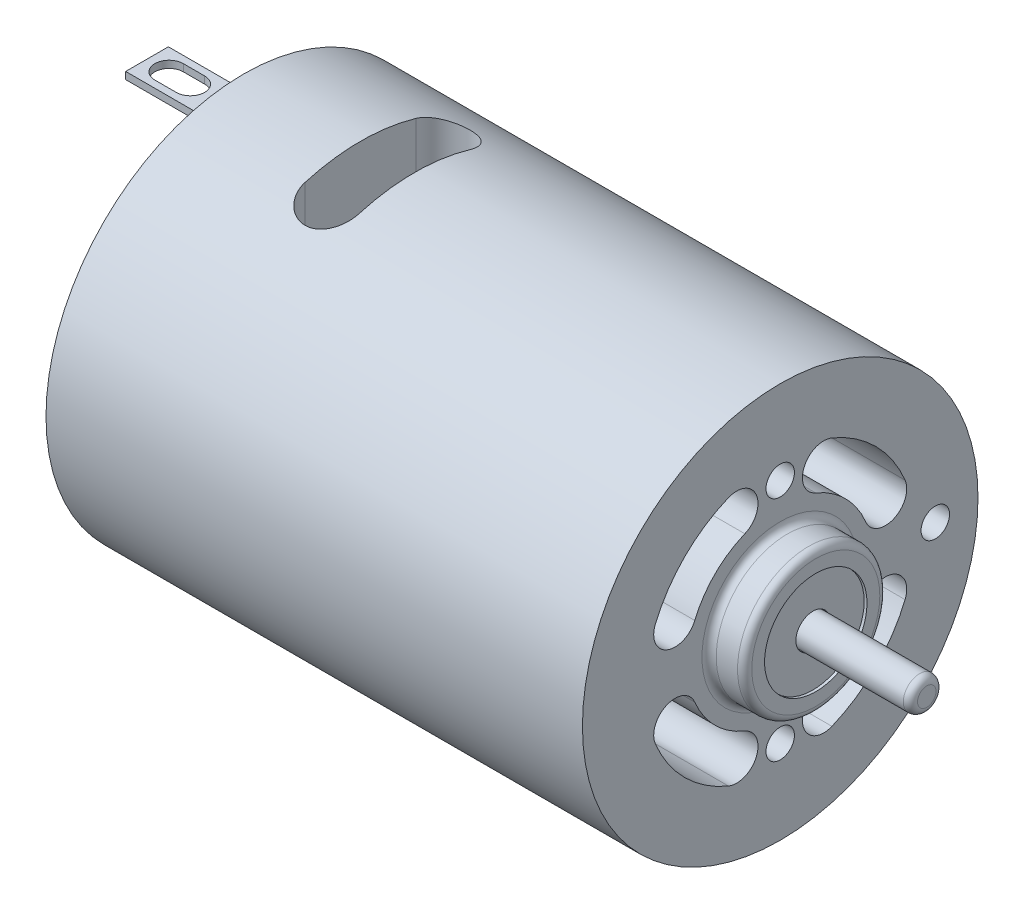
from build123d import *

# Parameters (mm, degrees)
SKETCH_1_R               = 13.9
EXTRUDE_1_DEPTH          = 37.7
CUT_EXTRUDE_1_DEPTH      = 43.517173001
CUT_EXTRUDE_1_DEPTH_BACK = 43.517173001
SKETCH_3_R               = 13.7
CUT_EXTRUDE_2_DEPTH      = 1
EXTRUDE_START            = 1
EXTRUDE_7_DEPTH          = 1
SKETCH_6_4_W             = 3
SKETCH_6_4_H             = 0.5
EXTRUDE_8_DEPTH          = 6.8
CUT_EXTRUDE_4_DEPTH      = 48.482523263
SKETCH_4_W               = 17.082447132
SKETCH_4_H               = 17
EXTRUDE_2_DEPTH          = 1
SKETCH_5_R               = 1.15
EXTRUDE_3_DEPTH          = 4
SKETCH_5_3_R             = 5
EXTRUDE_4_DEPTH          = 2
SKETCH_5_4_R             = 3
EXTRUDE_5_DEPTH          = 3
CUT_EXTRUDE_START        = 1
SKETCH_5_5_R             = 2.25
SKETCH_5_5_R_2           = 1.15
CUT_EXTRUDE_3_DEPTH      = 2
FILLET_1_R               = 1
FILLET_2_R               = 1
FILLET_3_R               = 0.5
EXTRUDE_START_2          = 2.5
SKETCH_8_R               = 5
SKETCH_8_R_2             = 3.6
EXTRUDE_9_DEPTH          = 2.5
EXTRUDE_START_3          = 2.3
SKETCH_8_3_R             = 3.6
SKETCH_8_3_R_2           = 1.2
EXTRUDE_10_DEPTH         = 2.3
EXTRUDE_START_4          = 10.3
SKETCH_8_4_R             = 1.15
EXTRUDE_11_DEPTH         = 10.3
FILLET_4_R               = 0.5
FILLET_5_R               = 0.5
FILLET_6_R               = 0.5
SKETCH_9_R               = 1
CUT_EXTRUDE_5_DEPTH      = 10
CUT_EXTRUDE_START_2      = -10
CUT_EXTRUDE_6_DEPTH      = 10
CHAMFER_1_SIZE           = 1


with BuildPart() as part:
    # 草图1 → 凸台-拉伸1 (new body)
    with BuildSketch(Plane(origin=(0, 0, 0), x_dir=(0, 0, -1), z_dir=(1, 0, 0))):
        Circle(SKETCH_1_R)
    extrude(amount=EXTRUDE_1_DEPTH)

    # 草图2 → 切除-拉伸1 (cut, two sides: drawn at the far end of the back side and taken through both)
    with BuildSketch(Plane(origin=(0, 0, 0), x_dir=(1, 0, 0), z_dir=(0, 1, 0)).offset(-CUT_EXTRUDE_1_DEPTH_BACK)):
        with BuildLine():
            Line((12, 3.9), (12, -3.9))
            ThreePointArc((12, -3.9), (10.1, -5.8), (8.2, -3.9))
            Line((8.2, -3.9), (8.2, 3.9))
            ThreePointArc((8.2, 3.9), (10.1, 5.8), (12, 3.9))
        make_face()
    extrude(amount=CUT_EXTRUDE_1_DEPTH + CUT_EXTRUDE_1_DEPTH_BACK, mode=Mode.SUBTRACT)

    # 草图3 → 切除-拉伸2 (cut)
    with BuildSketch(Plane.ZY):
        Circle(SKETCH_3_R)
    extrude(amount=-CUT_EXTRUDE_2_DEPTH, mode=Mode.SUBTRACT)

    # 草图6 → 凸台-拉伸7 (add)
    with BuildSketch(Plane.ZY.offset(-1).offset(EXTRUDE_START)):
        with BuildLine():
            Line((-3.85, -9.1), (-3.85, -13.147908579))
            ThreePointArc((-3.85, -13.147908579), (0, -13.7), (3.85, -13.147908579))
            Line((3.85, -13.147908579), (3.85, -9.1))
            Line((3.85, -9.1), (-3.85, -9.1))
        make_face()
        with BuildLine():
            Line((3.85, 9.1), (3.85, 13.147908579))
            ThreePointArc((3.85, 13.147908579), (0, 13.7), (-3.85, 13.147908579))
            Line((-3.85, 13.147908579), (-3.85, 9.1))
            Line((-3.85, 9.1), (3.85, 9.1))
        make_face()
    extrude(amount=-EXTRUDE_7_DEPTH)

    # 草图6<4> → 凸台-拉伸8 (add)
    with BuildSketch(Plane.ZY.offset(-1).offset(EXTRUDE_START)):
        with Locations((0, -11.15)):
            Rectangle(SKETCH_6_4_W, SKETCH_6_4_H)
        with Locations((0, 11.15)):
            Rectangle(SKETCH_6_4_W, SKETCH_6_4_H)
    extrude(amount=EXTRUDE_8_DEPTH)

    # 草图7 → 切除-拉伸4 (cut, through all)
    with BuildSketch(Plane.XZ.offset(11.4)):
        with BuildLine():
            Line((-5.25, 1), (-3.75, 1))
            ThreePointArc((-3.75, 1), (-2.75, 0), (-3.75, -1))
            Line((-3.75, -1), (-5.25, -1))
            ThreePointArc((-5.25, -1), (-6.25, 0), (-5.25, 1))
        make_face()
    extrude(amount=-CUT_EXTRUDE_4_DEPTH, mode=Mode.SUBTRACT)

    # 草图4 → 凸台-拉伸2 (add)
    with BuildSketch(Plane.ZY.offset(-1)):
        Rectangle(SKETCH_4_W, SKETCH_4_H)
        with BuildLine():
            ThreePointArc((-8.541223566, 8.5), (-12.05, 0), (-8.541223566, -8.5))
            Line((-8.541223566, -8.5), (-8.541223566, 8.5))
        make_face()
        with BuildLine():
            Line((8.541223566, 8.5), (8.541223566, -8.5))
            ThreePointArc((8.541223566, -8.5), (11.138317736, -4.597866681), (12.05, 0))
            ThreePointArc((12.05, 0), (11.138317736, 4.597866681), (8.541223566, 8.5))
        make_face()
    extrude(amount=EXTRUDE_2_DEPTH)

    # 草图5 → 凸台-拉伸3 (add)
    with BuildSketch(Plane.ZY):
        Circle(SKETCH_5_R)
    extrude(amount=EXTRUDE_3_DEPTH)

    # 草图5<3> → 凸台-拉伸4 (add)
    with BuildSketch(Plane.ZY):
        Circle(SKETCH_5_3_R)
    extrude(amount=EXTRUDE_4_DEPTH)

    # 草图5<4> → 凸台-拉伸5 (add)
    with BuildSketch(Plane.ZY):
        Circle(SKETCH_5_4_R)
    extrude(amount=EXTRUDE_5_DEPTH)

    # 草图5<5> → 切除-拉伸3 (cut)
    with BuildSketch(Plane.ZY.offset(CUT_EXTRUDE_START)):
        Circle(SKETCH_5_5_R)
        Circle(SKETCH_5_5_R_2, mode=Mode.SUBTRACT)
    extrude(amount=CUT_EXTRUDE_3_DEPTH, mode=Mode.SUBTRACT)

    # 圆角1
    fillet_1_edges = [part.edges().sort_by_distance(p)[0] for p in [
        (-2, 0, -5),
    ]]
    fillet(fillet_1_edges, radius=FILLET_1_R)

    # 圆角2
    # the kernel refuses this fillet: 1 mm, written as the material it takes off along each edge
    with BuildSketch(Plane(origin=(-3, 0, 0), x_dir=(0, 0, 1), z_dir=(0, -1, 0))) as fillet_2_piece_1:
        with BuildLine():
            CenterArc((2, -0.968245837), FILLET_2_R, 0, 75.522487814)
            Line((2.25, 0), (2.255, 0.019364917))
            ThreePointArc((2.255, 0.019364917), (2.625, 0.02), (3, 0.02))
            Line((3, 0.02), (3.02, 0))
            Line((3.02, 0), (3.02, -0.968245837))
            Line((3.02, -0.968245837), (3, -0.968245837))
        make_face()
    revolve(axis=Axis((-3, 0, 0), (-1, 0, 0)), mode=Mode.SUBTRACT)

    # 圆角3
    fillet_3_edges = [part.edges().sort_by_distance(p)[0] for p in [
        (-4, 0, -1.15),
    ]]
    fillet(fillet_3_edges, radius=FILLET_3_R)

    # 草图8 → 凸台-拉伸9 (add)
    with BuildSketch(Plane(origin=(37.7, 0, 0), x_dir=(0, 0, -1), z_dir=(1, 0, 0)).offset(EXTRUDE_START_2)):
        with Locations(Location((0, 0, 0), (0, 0, 180))):
            Circle(SKETCH_8_R)
        Circle(SKETCH_8_R_2, mode=Mode.SUBTRACT)
    extrude(amount=-EXTRUDE_9_DEPTH)

    # 草图8<3> → 凸台-拉伸10 (add)
    with BuildSketch(Plane(origin=(37.7, 0, 0), x_dir=(0, 0, -1), z_dir=(1, 0, 0)).offset(EXTRUDE_START_3)):
        Circle(SKETCH_8_3_R)
        Circle(SKETCH_8_3_R_2, mode=Mode.SUBTRACT)
    extrude(amount=-EXTRUDE_10_DEPTH)

    # 草图8<4> → 凸台-拉伸11 (add)
    with BuildSketch(Plane(origin=(37.7, 0, 0), x_dir=(0, 0, -1), z_dir=(1, 0, 0)).offset(EXTRUDE_START_4)):
        with Locations(Location((0, 0, 0), (0, 0, 180))):
            Circle(SKETCH_8_4_R)
    extrude(amount=-EXTRUDE_11_DEPTH)

    # 圆角4
    fillet_4_edges = [part.edges().sort_by_distance(p)[0] for p in [
        (48, 0, -1.15),
    ]]
    fillet(fillet_4_edges, radius=FILLET_4_R)

    # 圆角5
    fillet_5_edges = [part.edges().sort_by_distance(p)[0] for p in [
        (40.2, 0, -5),
    ]]
    fillet(fillet_5_edges, radius=FILLET_5_R)

    # 圆角6
    fillet_6_edges = [part.edges().sort_by_distance(p)[0] for p in [
        (37.7, 0, -5),
    ]]
    fillet(fillet_6_edges, radius=FILLET_6_R)

    # 草图9 → 切除-拉伸5 (cut)
    with BuildSketch(Plane(origin=(37.7, 0, 0), x_dir=(0, 0, -1), z_dir=(1, 0, 0))):
        with BuildLine():
            ThreePointArc((2.487442249, 6.005216987), (4.596194074, 4.596194082), (6.005216982, 2.48744226))
            ThreePointArc((6.005216982, 2.48744226), (7.965061461, 1.675648182), (8.776855536, 3.635492661))
            ThreePointArc((8.776855536, 3.635492661), (6.7175144, 6.717514442), (3.635492607, 8.776855559))
            ThreePointArc((3.635492607, 8.776855559), (1.675648173, 7.965061439), (2.487442249, 6.005216987))
        make_face()
        with BuildLine():
            ThreePointArc((6.005216945, -2.48744235), (4.596194039, -4.596194116), (2.487442249, -6.005216987))
            ThreePointArc((2.487442249, -6.005216987), (1.675648184, -7.965061466), (3.635492661, -8.776855536))
            ThreePointArc((3.635492661, -8.776855536), (6.717514416, -6.717514426), (8.776855531, -3.635492674))
            ThreePointArc((8.776855531, -3.635492674), (7.965061422, -1.675648166), (6.005216945, -2.48744235))
        make_face()
        with BuildLine():
            ThreePointArc((-6.005216994, 2.487442232), (-4.596194128, 4.596194027), (-2.487442365, 6.005216939))
            ThreePointArc((-2.487442365, 6.005216939), (-1.67564816, 7.965061408), (-3.635492661, 8.776855536))
            ThreePointArc((-3.635492661, 8.776855536), (-6.717514442, 6.7175144), (-8.776855559, 3.635492607))
            ThreePointArc((-8.776855559, 3.635492607), (-7.965061447, 1.675648176), (-6.005216994, 2.487442232))
        make_face()
        with BuildLine():
            ThreePointArc((-2.487442378, -6.005216933), (-4.596194133, -4.596194022), (-6.005216994, -2.487442232))
            ThreePointArc((-6.005216994, -2.487442232), (-7.965061447, -1.675648176), (-8.776855559, -3.635492607))
            ThreePointArc((-8.776855559, -3.635492607), (-6.717514442, -6.7175144), (-3.635492662, -8.776855536))
            ThreePointArc((-3.635492662, -8.776855536), (-1.675648157, -7.965061402), (-2.487442378, -6.005216933))
        make_face()
        with Locations((0, 8)):
            Circle(SKETCH_9_R)
        with Locations((0, -8)):
            Circle(SKETCH_9_R)
        with Locations((10.9, 0)):
            Circle(SKETCH_9_R)
    extrude(amount=-CUT_EXTRUDE_5_DEPTH, mode=Mode.SUBTRACT)

    # 草图11 → 切除-拉伸6 (cut)
    with BuildSketch(Plane.ZY.offset(CUT_EXTRUDE_START_2)):
        with BuildLine():
            Line((-7.25, 7.25), (-7.25, 2.8))
            Line((-7.25, 2.8), (-5.86600375, 2.8))
            ThreePointArc((-5.86600375, 2.8), (-4.596194078, 4.596194078), (-2.8, 5.86600375))
            Line((-2.8, 5.86600375), (-2.8, 7.25))
            Line((-2.8, 7.25), (-7.25, 7.25))
        make_face()
        with BuildLine():
            Line((2.8, 7.25), (2.8, 5.86600375))
            ThreePointArc((2.8, 5.86600375), (4.596194078, 4.596194078), (5.86600375, 2.8))
            Line((5.86600375, 2.8), (7.25, 2.8))
            Line((7.25, 2.8), (7.25, 7.25))
            Line((7.25, 7.25), (2.8, 7.25))
        make_face()
        with BuildLine():
            ThreePointArc((5.86600375, -2.8), (4.596194078, -4.596194078), (2.8, -5.86600375))
            Line((2.8, -5.86600375), (2.8, -7.25))
            Line((2.8, -7.25), (7.25, -7.25))
            Line((7.25, -7.25), (7.25, -2.8))
            Line((7.25, -2.8), (5.86600375, -2.8))
        make_face()
        with BuildLine():
            Line((-5.86600375, -2.8), (-7.25, -2.8))
            Line((-7.25, -2.8), (-7.25, -7.25))
            Line((-7.25, -7.25), (-2.8, -7.25))
            Line((-2.8, -7.25), (-2.8, -5.86600375))
            ThreePointArc((-2.8, -5.86600375), (-4.596194078, -4.596194078), (-5.86600375, -2.8))
        make_face()
    extrude(amount=CUT_EXTRUDE_6_DEPTH, mode=Mode.SUBTRACT)

    # 倒角1
    chamfer_1_edges = [part.edges().sort_by_distance(p)[0] for p in [
        (5, -7.25, -7.25),
        (5, -7.25, 7.25),
        (5, 7.25, 7.25),
        (5, 7.25, -7.25),
    ]]
    chamfer(chamfer_1_edges, length=CHAMFER_1_SIZE)


solid = part.part
